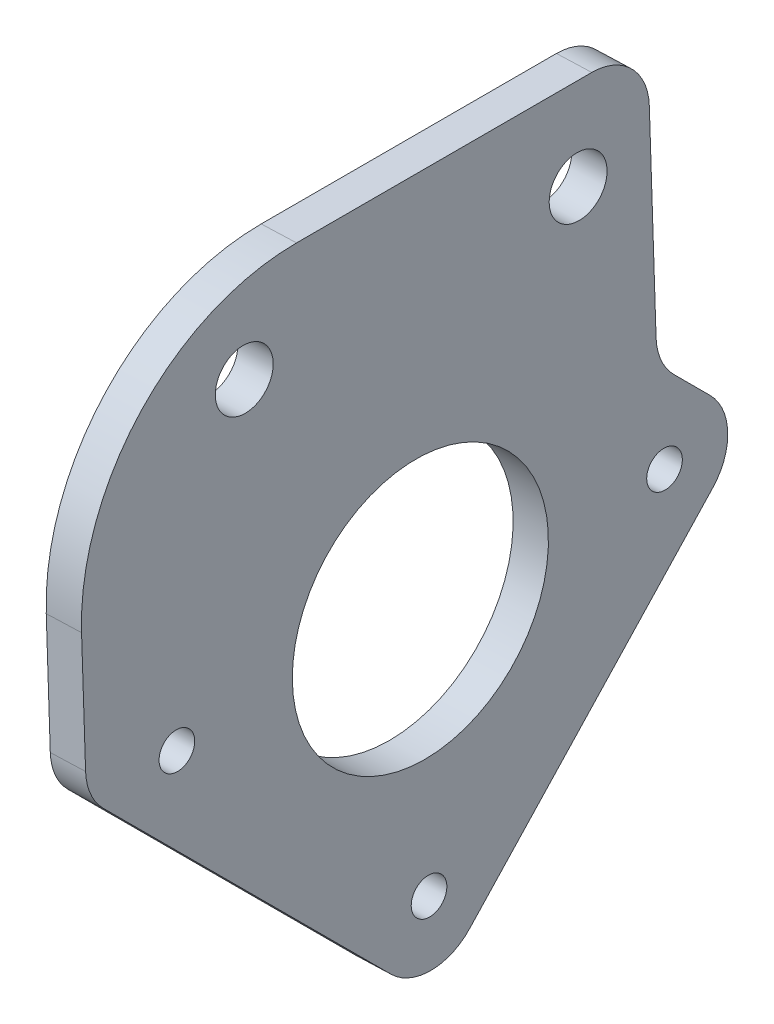
from build123d import *

# Parameters (mm, degrees)
BASE_FLANGE1_DEPTH             = 3.175
F_23_0_23_DIAMETER_HOLE1_D     = 23
F_23_0_23_DIAMETER_HOLE1_DEPTH = 5.245059642
F_5_2_5_2_DIAMETER_HOLE1_D     = 5.2
F_5_2_5_2_DIAMETER_HOLE1_DEPTH = 5.245059642
F_3_2_3_2_DIAMETER_HOLE1_D     = 3.2
F_3_2_3_2_DIAMETER_HOLE1_DEPTH = 5.245059642


# Sheet-metal steps are written as plain solids
with BuildPart() as part:
    # Sketch11 → Base-Flange1 (new body)
    with BuildSketch(Plane(origin=(158.683156088, 5.425207604, 0), x_dir=(0.03416896788300158, -0.9994160703299755, 0), z_dir=(-0.9994160703299755, -0.03416896788300158, -1.3885688057658037e-15))):
        with BuildLine():
            Line((-62.15623968, 394.926215189), (-62.15623968, 368.398551724))
            ThreePointArc((-62.15623968, 368.398551724), (-60.691773586, 364.863017818), (-57.15623968, 363.398551724))
            Line((-57.15623968, 363.398551724), (-39.397236161, 363.398551724))
            ThreePointArc((-39.397236161, 363.398551724), (-37.483818999, 363.017949386), (-35.861702255, 361.93408563))
            Line((-35.861702255, 361.93408563), (-32.700762633, 358.773146007))
            ThreePointArc((-32.700762633, 358.773146007), (-29.165228727, 357.308679913), (-25.629694821, 358.773146007))
            Line((-25.629694821, 358.773146007), (-3.002277823, 381.400563005))
            ThreePointArc((-3.002277823, 381.400563005), (-1.537811729, 384.936096911), (-3.002277823, 388.471630817))
            Line((-3.002277823, 388.471630817), (-27.992396101, 413.461749095))
            ThreePointArc((-27.992396101, 413.461749095), (-29.614512845, 414.545612852), (-31.527930007, 414.926215189))
            Line((-31.527930007, 414.926215189), (-42.15623968, 414.926215189))
            ThreePointArc((-42.15623968, 414.926215189), (-56.298375303, 409.068350813), (-62.15623968, 394.926215189))
        make_face()
    extrude(amount=-BASE_FLANGE1_DEPTH)

    # Ø23.0 (23) Diameter Hole1
    with Locations(Plane(origin=(158.683156088, 5.425207604, 0), x_dir=(0, 0, 1), z_dir=(-0.9994160703299755, -0.03416896788300158, -1.3885688057658039e-15))):
        with Locations((384.926215189, 29.191594771)):
            Hole(F_23_0_23_DIAMETER_HOLE1_D / 2, depth=F_23_0_23_DIAMETER_HOLE1_DEPTH)

    # Ø5.2 (5.2) Diameter Hole1
    with Locations(Plane(origin=(158.683156088, 5.425207604, 0), x_dir=(0, 0, 1), z_dir=(-0.9994160703299755, -0.03416896788300158, -1.3885688057658039e-15))):
        with Locations((369.898551724, 54.15623968), (399.898551724, 54.15623968)):
            Hole(F_5_2_5_2_DIAMETER_HOLE1_D / 2, depth=F_5_2_5_2_DIAMETER_HOLE1_DEPTH)

    # Ø3.2 (3.2) Diameter Hole1
    with Locations(Plane(origin=(158.683156088, 5.425207604, 0), x_dir=(0, 0, 1), z_dir=(-0.9994160703299755, -0.03416896788300158, -1.3885688057658039e-15))):
        with Locations((406.806051724, 29.127683539), (362.991051724, 29.127683539), (384.898551724, 7.220183539)):
            Hole(F_3_2_3_2_DIAMETER_HOLE1_D / 2, depth=F_3_2_3_2_DIAMETER_HOLE1_DEPTH)


solid = part.part
